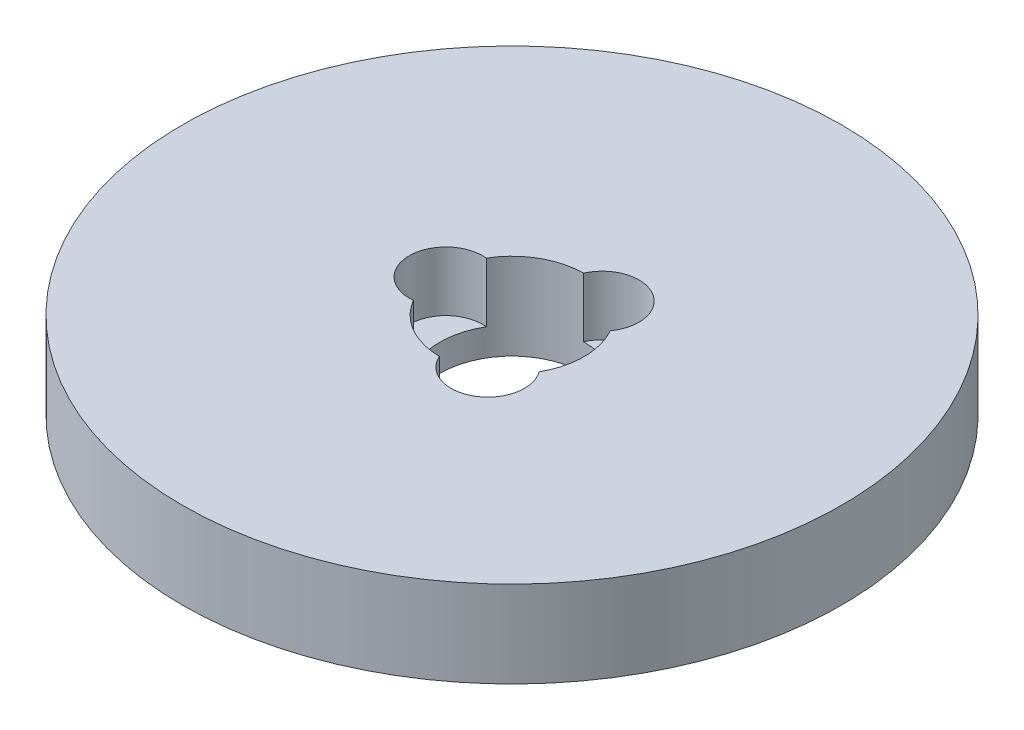
from build123d import *

# Parameters (mm, degrees)
SKETCH1_R           = 80
BOSS_EXTRUDE1_DEPTH = 21
SKETCH2_R           = 17.5
CUT_EXTRUDE1_DEPTH  = 116.06954419
SKETCH3_R           = 8.911331439
CUT_EXTRUDE2_DEPTH  = 14.434003831
CIRPATTERN1_COUNT   = 3


with BuildPart() as part:
    # Sketch1 → Boss-Extrude1 (new body)
    with BuildSketch(Plane(origin=(0, 0, 0), x_dir=(1, 0, 0), z_dir=(0, 1, 0))):
        Circle(SKETCH1_R)
    extrude(amount=BOSS_EXTRUDE1_DEPTH)

    # Sketch2 → Cut-Extrude1 (cut, through all)
    with BuildSketch(Plane(origin=(0, 0, 0), x_dir=(1, 0, 0), z_dir=(0, 1, 0))):
        Circle(SKETCH2_R)
    extrude(amount=CUT_EXTRUDE1_DEPTH, mode=Mode.SUBTRACT)

    # Sketch3 → Cut-Extrude2 (cut)
    with BuildSketch(Plane(origin=(0, 21, 0), x_dir=(1, 0, 0), z_dir=(0, 1, 0))):
        with Locations((-16.04193294, 0)):
            Circle(SKETCH3_R)
    cut_extrude2 = extrude(amount=-CUT_EXTRUDE2_DEPTH, mode=Mode.SUBTRACT)

    # CirPattern1: Cut-Extrude2 ×3 about axis
    cirpattern1_axis = Axis((0, 0, 0), (0, 1, 0))
    for i in range(1, CIRPATTERN1_COUNT):
        add(cut_extrude2.rotate(cirpattern1_axis, i * 360 / CIRPATTERN1_COUNT), mode=Mode.SUBTRACT)


solid = part.part
